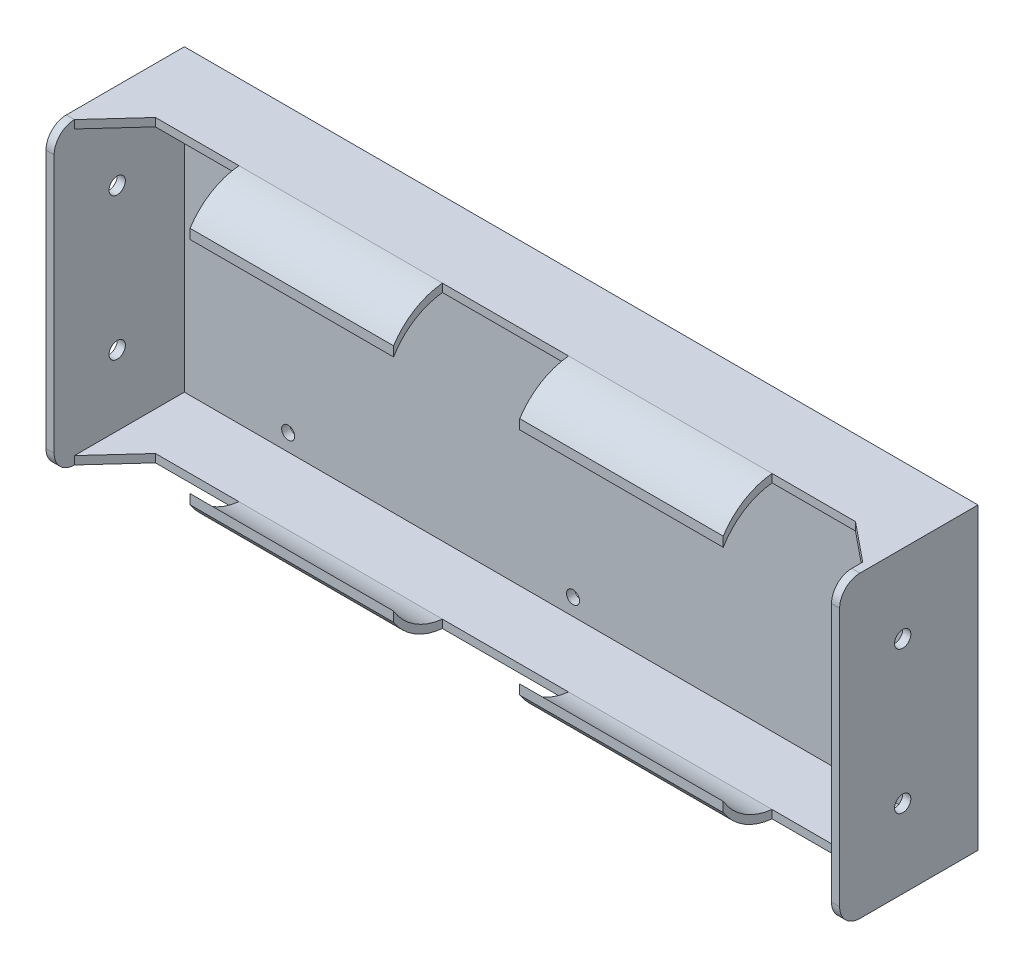
from build123d import *

# Parameters (mm, degrees)
SKETCH1_W            = 195
SKETCH1_H            = 73.5
SKETCH1_R            = 1.6
BOSS_EXTRUDE1_DEPTH  = 2
SKETCH2_W            = 2
SKETCH2_H            = 73.5
BOSS_EXTRUDE2_DEPTH  = 32
BOSS_EXTRUDE3_DEPTH  = 2
BOSS_EXTRUDE4_DEPTH  = 50
MIRROR3_COPY_1_DEPTH = 50
FILLET1_R            = 5
SKETCH6_R            = 1
BOSS_EXTRUDE5_DEPTH  = 15
SKETCH7_R            = 2
CUT_EXTRUDE1_DEPTH   = 212.147460321


with BuildPart() as part:
    # Sketch1 → Boss-Extrude1 (new body)
    with BuildSketch(Plane.XY):
        with Locations((97.5, 36.75)):
            Rectangle(SKETCH1_W, SKETCH1_H)
        with Locations((27.5, 67.364107359)):
            Circle(SKETCH1_R, mode=Mode.SUBTRACT)
        with Locations((97.5, 67.364107359)):
            Circle(SKETCH1_R, mode=Mode.SUBTRACT)
        with Locations((167.5, 67.364107359)):
            Circle(SKETCH1_R, mode=Mode.SUBTRACT)
        with Locations((167.5, 6.135892641)):
            Circle(SKETCH1_R, mode=Mode.SUBTRACT)
        with Locations((97.5, 6.135892641)):
            Circle(SKETCH1_R, mode=Mode.SUBTRACT)
        with Locations((27.5, 6.135892641)):
            Circle(SKETCH1_R, mode=Mode.SUBTRACT)
    extrude(amount=BOSS_EXTRUDE1_DEPTH)

    # Sketch2 → Boss-Extrude2 (add)
    with BuildSketch(Plane.XY.offset(2)):
        with Locations((1, 36.75)):
            Rectangle(SKETCH2_W, SKETCH2_H)
        with Locations((194, 36.75)):
            Rectangle(SKETCH2_W, SKETCH2_H)
    extrude(amount=BOSS_EXTRUDE2_DEPTH)

    # Sketch3 → Boss-Extrude3 (add)
    with BuildSketch(Plane.XZ):
        Polygon((0, 0), (0, 29), (2, 29), (11.5, 18.6), (183.5, 18.6), (193, 26.325039357), (195, 26.325039357), (195, 0), align=None)
    boss_extrude3 = extrude(amount=-BOSS_EXTRUDE3_DEPTH)

    # Mirror1: Boss-Extrude3 across plane
    add(boss_extrude3.mirror(Plane(origin=(0, 36.75, 0), x_dir=(0, 0, 1), z_dir=(0, -1, 0))))

    # 3DSketch1 → Boss-Extrude4 (add)
    with BuildSketch(Plane(origin=(32, 0, 18.6), x_dir=(0, 0.995265198446773, -0.09719662936905633), z_dir=(1, 0, 0))):
        with BuildLine():
            Line((0, 0), (1.990530397, 0.194393259))
            ThreePointArc((1.990530397, 0.194393259), (3.755453085, 7.307606505), (8.506639352, 12.887838028))
            Line((8.506639352, 12.887838028), (6.133305317, 12.656060539))
            ThreePointArc((6.133305317, 12.656060539), (1.603781504, 7.03695825), (0, 0))
        make_face()
    boss_extrude4 = extrude(amount=BOSS_EXTRUDE4_DEPTH)

    # Mirror2: Boss-Extrude4 across plane
    add(boss_extrude4.mirror(Plane(origin=(97.5, 0, 0), x_dir=(0, 0, 1), z_dir=(1, 0, 0))))

    # Mirror3: Boss-Extrude4 across plane
    add(boss_extrude4.mirror(Plane(origin=(0, 36.75, 0), x_dir=(0, 0, 1), z_dir=(0, -1, 0))))

    # Mirror3 copy 1 sketch → Mirror3 copy 1 (add)
    with BuildSketch(Plane(origin=(163, 73.5, 18.6), x_dir=(0, -0.995265198446773, -0.09719662936905633), z_dir=(-1, 0, 0))):
        with BuildLine():
            Line((0, 0), (1.990530397, 0.194393259))
            ThreePointArc((1.990530397, 0.194393259), (3.755453085, 7.307606505), (8.506639352, 12.887838028))
            Line((8.506639352, 12.887838028), (6.133305317, 12.656060539))
            ThreePointArc((6.133305317, 12.656060539), (1.603781504, 7.03695825), (0, 0))
        make_face()
    extrude(amount=MIRROR3_COPY_1_DEPTH)

    # Fillet1
    fillet1_edges = [part.edges().sort_by_distance(p)[0] for p in [
        (1, 0, 34),
        (1, 73.5, 34),
        (194, 73.5, 34),
        (194, 0, 34),
    ]]
    fillet(fillet1_edges, radius=FILLET1_R)

    # Sketch6 → Boss-Extrude5 (add)
    with BuildSketch(Plane.ZY):
        with Locations((5, 46.75)):
            Circle(SKETCH6_R)
        with Locations((5, 26.75)):
            Circle(SKETCH6_R)
    extrude(amount=BOSS_EXTRUDE5_DEPTH)

    # Sketch7 → Cut-Extrude1 (cut, through all)
    with BuildSketch(Plane.ZY):
        with Locations((18.5, 54.25)):
            Circle(SKETCH7_R)
        with Locations((18.5, 19.25)):
            Circle(SKETCH7_R)
    extrude(amount=-CUT_EXTRUDE1_DEPTH, mode=Mode.SUBTRACT)


solid = part.part
